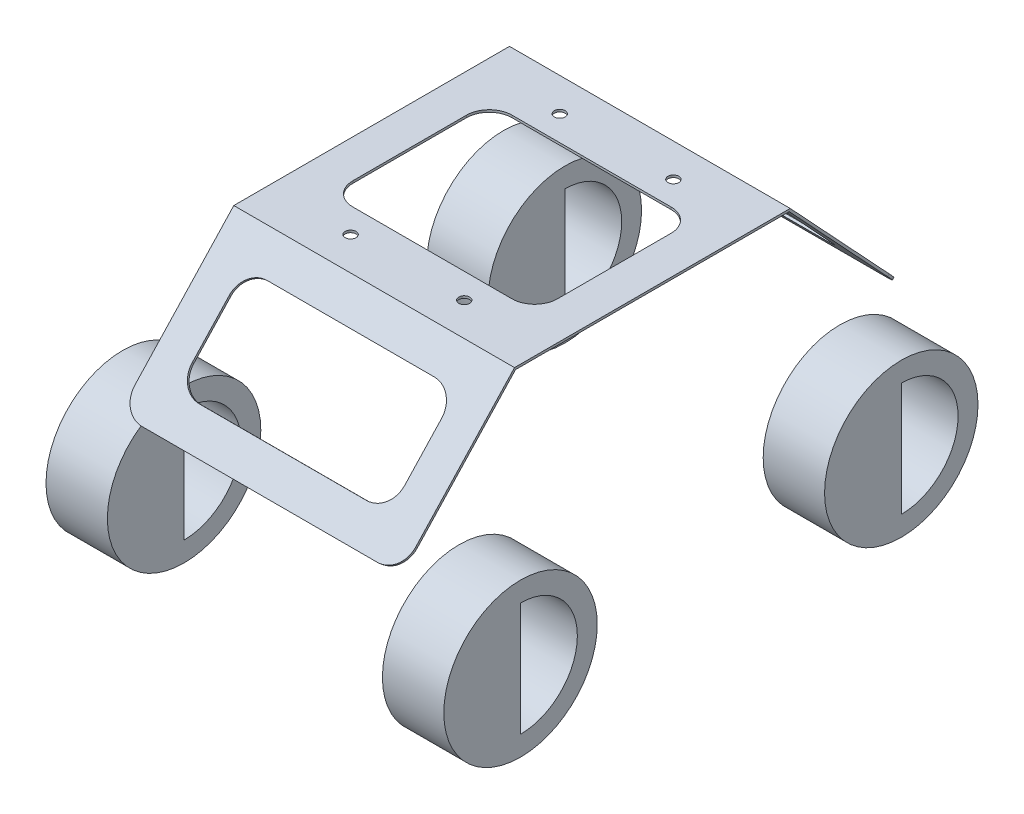
from build123d import *

# Parameters (mm, degrees)
ESBO_O1_W                  = 175
ESBO_O1_H                  = 235
RESSALTO_EXTRUS_O1_DEPTH   = 67.5
FILETE1_R                  = 33.75
CORTE_EXTRUS_O1_DEPTH      = 222.331199789
CORTE_EXTRUS_O2_DEPTH      = 162.303285769
CORTE_EXTRUS_O2_DEPTH_BACK = 162.303285769
ESBO_O3_W                  = 121
ESBO_O3_H                  = 67.5
ESBO_O4_W                  = 123.5
ESBO_O4_H                  = 222
RESSALTO_EXTRUS_O2_DEPTH   = 54
CORTE_EXTRUS_O3_DEPTH      = 227.843145147
ESBO_O7_R                  = 2.4
CORTE_EXTRUS_O4_DEPTH      = 192.933582262
CORTE_EXTRUS_O5_DEPTH      = 10
CORTE_EXTRUS_O6_DEPTH      = 245.555208491


with BuildPart() as part:
    # Esboço1 → Ressalto-extrusão1 (new body)
    with BuildSketch(Plane(origin=(0, 0, 0), x_dir=(1, 0, 0), z_dir=(0, 1, 0))):
        Rectangle(ESBO_O1_W, ESBO_O1_H)
    extrude(amount=RESSALTO_EXTRUS_O1_DEPTH)

    # Filete1
    filete1_edges = [part.edges().sort_by_distance(p)[0] for p in [
        (0, 0, -117.5),
        (0, 67.5, -117.5),
        (0, 0, 117.5),
        (0, 67.5, 117.5),
    ]]
    fillet(filete1_edges, radius=FILETE1_R - 0.0001)  # a hair under: the kernel refuses the full size

    # Esboço2 → Corte-extrusão1 (cut, through all)
    with BuildSketch(Plane(origin=(87.5, 0, 0), x_dir=(0, 0, -1), z_dir=(1, 0, 0))):
        with BuildLine():
            Line((-83.75, 67.5), (83.75, 67.5))
            ThreePointArc((83.75, 67.5), (50, 33.75), (83.75, 0))
            Line((83.75, 0), (-83.75, 0))
            ThreePointArc((-83.75, 0), (-50, 33.75), (-83.75, 67.5))
        make_face()
    extrude(amount=-CORTE_EXTRUS_O1_DEPTH, mode=Mode.SUBTRACT)


with BuildPart() as corte_extrus_o1_piece_1:
    # of the separate pieces the step leaves, piece 1, a body of its own (corte_extrus_o1_pieces)
    add(part.part.solids().sort_by_distance((-87.5, 33.7499, -117.5))[0])


with BuildPart() as corte_extrus_o1_piece_2:
    # of the separate pieces the step leaves, piece 2, a body of its own (corte_extrus_o1_pieces)
    add(part.part.solids().sort_by_distance((-87.5, 33.7499, 117.5))[0])


with BuildPart() as corte_extrus_o2_tool:
    # Esboço3 → Corte-extrusão2 (new, two sides: drawn at the far end of the back side and taken through both)
    with BuildSketch(Plane.XY.offset(-CORTE_EXTRUS_O2_DEPTH_BACK)):
        with Locations((0, 33.75)):
            Rectangle(ESBO_O3_W, ESBO_O3_H)
    extrude(amount=CORTE_EXTRUS_O2_DEPTH + CORTE_EXTRUS_O2_DEPTH_BACK)


with BuildPart() as corte_extrus_o1_piece_1_1:
    add(corte_extrus_o1_piece_1.part)

    # Corte-extrusão2: cut by corte_extrus_o2_tool
    add(corte_extrus_o2_tool.part, mode=Mode.SUBTRACT)


with BuildPart() as corte_extrus_o1_piece_2_1:
    add(corte_extrus_o1_piece_2.part)

    # Corte-extrusão2: cut by corte_extrus_o2_tool
    add(corte_extrus_o2_tool.part, mode=Mode.SUBTRACT)


with BuildPart() as corte_extrus_o2_piece_1:
    # of the separate pieces the step leaves, piece 1, a body of its own (corte_extrus_o2_pieces)
    add(corte_extrus_o1_piece_1_1.part.solids().sort_by_distance((-87.5, 33.7499, -117.5))[0])


with BuildPart() as corte_extrus_o2_piece_2:
    # of the separate pieces the step leaves, piece 2, a body of its own (corte_extrus_o2_pieces)
    add(corte_extrus_o1_piece_1_1.part.solids().sort_by_distance((60.5, 33.7499, -117.5))[0])


with BuildPart() as corte_extrus_o2_piece_1_of_corte_extrus:
    # of the separate pieces the step leaves, piece 1, a body of its own (corte_extrus_o2_pieces_of_corte_extrus_o)
    add(corte_extrus_o1_piece_2_1.part.solids().sort_by_distance((87.5, 33.7499, 117.5))[0])


with BuildPart() as corte_extrus_o2_piece_2_of_corte_extrus:
    # of the separate pieces the step leaves, piece 2, a body of its own (corte_extrus_o2_pieces_of_corte_extrus_o)
    add(corte_extrus_o1_piece_2_1.part.solids().sort_by_distance((-87.5, 33.7499, 117.5))[0])


with BuildPart() as body_5:
    # Esboço4 → Ressalto-extrusão2 (new body)
    with BuildSketch(Plane(origin=(0, 70, 0), x_dir=(1, 0, 0), z_dir=(0, 1, 0))):
        Rectangle(ESBO_O4_W, ESBO_O4_H)
    extrude(amount=RESSALTO_EXTRUS_O2_DEPTH)

    # Esboço6 → Corte-extrusão3 (cut, through all)
    with BuildSketch(Plane(origin=(61.75, 0, 0), x_dir=(0, 0, -1), z_dir=(1, 0, 0))):
        Polygon((-111, 70), (-111, 124), (-60.644185349, 124), align=None)
        Polygon((111, 124), (111, 70), (60.644185349, 124), align=None)
        Polygon((-109.632672539, 70), (-60.209372974, 123), (60.209372974, 123), (109.632672539, 70), align=None)
    extrude(amount=-CORTE_EXTRUS_O3_DEPTH, mode=Mode.SUBTRACT)

    # Esboço7 → Corte-extrusão4 (cut, through all)
    with BuildSketch(Plane(origin=(0, 124, 0), x_dir=(1, 0, 0), z_dir=(0, 1, 0))):
        with Locations(Location((-25, -46, 0), (0, 0, 270))):
            Circle(ESBO_O7_R)
        with Locations(Location((25, -46, 0), (0, 0, 270))):
            Circle(ESBO_O7_R)
        with Locations(Location((-25, 46, 0), (0, 0, 270))):
            Circle(ESBO_O7_R)
        with Locations(Location((25, 46, 0), (0, 0, 270))):
            Circle(ESBO_O7_R)
        with BuildLine():
            Line((-35, 35), (35, 35))
            ThreePointArc((35, 35), (42.071067812, 32.071067812), (45, 25))
            Line((45, 25), (45, -25))
            ThreePointArc((45, -25), (42.071067812, -32.071067812), (35, -35))
            Line((35, -35), (-35, -35))
            ThreePointArc((-35, -35), (-42.071067812, -32.071067812), (-45, -25))
            Line((-45, -25), (-45, 25))
            ThreePointArc((-45, 25), (-42.071067812, 32.071067812), (-35, 35))
        make_face()
    extrude(amount=-CORTE_EXTRUS_O4_DEPTH, mode=Mode.SUBTRACT)

    # Esboço8 → Corte-extrusão5 (cut)
    with BuildSketch(Plane(origin=(0, 87.923328208, -94.286226052), x_dir=(-1, 0, 0), z_dir=(0, 0.6819983600624947, -0.731353701619174))):
        with BuildLine():
            Line((-36.75, 34.328624046), (36.75, 34.328624046))
            ThreePointArc((36.75, 34.328624046), (43.821067812, 31.399691858), (46.75, 24.328624046))
            Line((46.75, 24.328624046), (46.75, 0.492941146))
            ThreePointArc((46.75, 0.492941146), (43.821067812, -6.578126665), (36.75, -9.507058854))
            Line((36.75, -9.507058854), (-36.75, -9.507058854))
            ThreePointArc((-36.75, -9.507058854), (-43.821067812, -6.578126665), (-46.75, 0.492941146))
            Line((-46.75, 0.492941146), (-46.75, 24.328624046))
            ThreePointArc((-46.75, 24.328624046), (-43.821067812, 31.399691858), (-36.75, 34.328624046))
        make_face()
        with BuildLine():
            Line((-61.75, -24.507058854), (-51.75, -24.507058854))
            ThreePointArc((-51.75, -24.507058854), (-58.821067812, -21.578126665), (-61.75, -14.507058854))
            Line((-61.75, -14.507058854), (-61.75, -24.507058854))
        make_face()
        with BuildLine():
            ThreePointArc((61.75, -14.507058854), (58.821067812, -21.578126665), (51.75, -24.507058854))
            Line((51.75, -24.507058854), (61.75, -24.507058854))
            Line((61.75, -24.507058854), (61.75, -14.507058854))
        make_face()
    corte_extrus_o5 = extrude(amount=-CORTE_EXTRUS_O5_DEPTH, mode=Mode.SUBTRACT)

    # Espelhar1: Corte-extrusão5 across plane
    add(corte_extrus_o5.mirror(Plane.XY), mode=Mode.SUBTRACT)


with BuildPart() as corte_extrus_o6_tool:
    # Esboço9 → Corte-extrusão6 (new, through all)
    with BuildSketch(Plane(origin=(87.5, 0, 0), x_dir=(0, 0, -1), z_dir=(1, 0, 0))):
        with BuildLine():
            Line((-83.75, 58.75), (-83.75, 8.75))
            ThreePointArc((-83.75, 8.75), (-58.75, 33.75), (-83.75, 58.75))
        make_face()
        with BuildLine():
            Line((83.75, 58.75), (83.75, 8.75))
            ThreePointArc((83.75, 8.75), (108.75, 33.75), (83.75, 58.75))
        make_face()
    extrude(amount=-CORTE_EXTRUS_O6_DEPTH)


with BuildPart() as corte_extrus_o2_piece_1_1:
    add(corte_extrus_o2_piece_1.part)

    # Corte-extrusão6: cut by corte_extrus_o6_tool
    add(corte_extrus_o6_tool.part, mode=Mode.SUBTRACT)


with BuildPart() as corte_extrus_o2_piece_2_1:
    add(corte_extrus_o2_piece_2.part)

    # Corte-extrusão6: cut by corte_extrus_o6_tool
    add(corte_extrus_o6_tool.part, mode=Mode.SUBTRACT)


with BuildPart() as corte_extrus_o2_piece_1_of_corte_extrus_1:
    add(corte_extrus_o2_piece_1_of_corte_extrus.part)

    # Corte-extrusão6: cut by corte_extrus_o6_tool
    add(corte_extrus_o6_tool.part, mode=Mode.SUBTRACT)


with BuildPart() as corte_extrus_o2_piece_2_of_corte_extrus_1:
    add(corte_extrus_o2_piece_2_of_corte_extrus.part)

    # Corte-extrusão6: cut by corte_extrus_o6_tool
    add(corte_extrus_o6_tool.part, mode=Mode.SUBTRACT)


solid = Compound([body_5.part, corte_extrus_o2_piece_1_1.part, corte_extrus_o2_piece_2_1.part, corte_extrus_o2_piece_1_of_corte_extrus_1.part, corte_extrus_o2_piece_2_of_corte_extrus_1.part])
